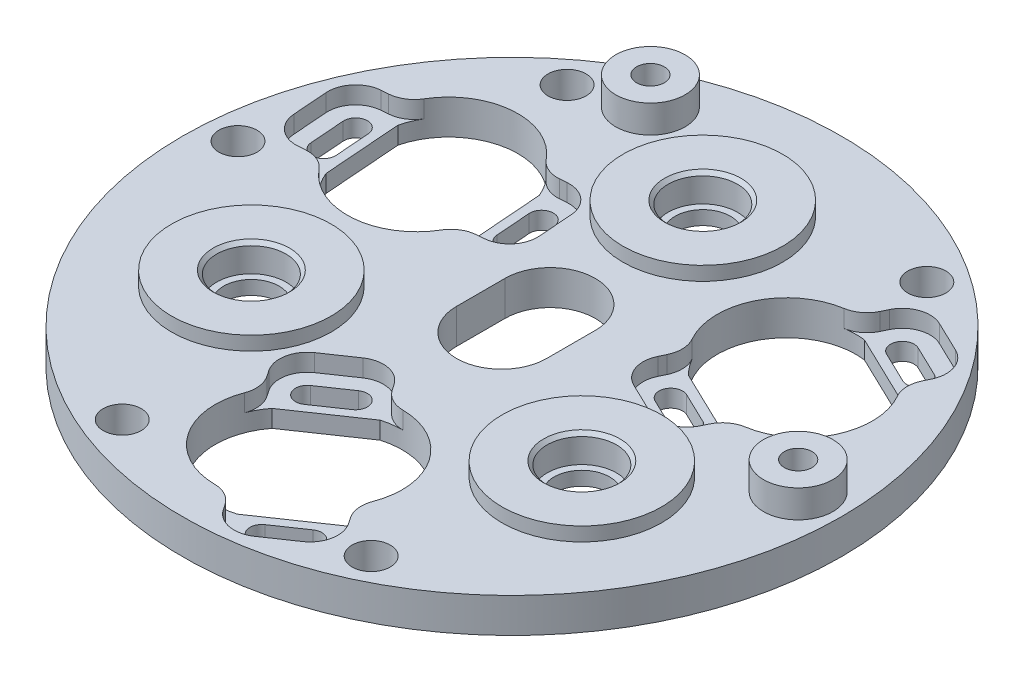
from build123d import *

# Parameters (mm, degrees)
CIRPATTERN1_COUNT            = 3
BOSS_EXTRUDE3_START          = -4
SKETCH3_R                    = 47.5
SKETCH3_R_2                  = 11.5
SKETCH3_R_3                  = 10
BOSS_EXTRUDE3_DEPTH          = 5
R_P_TITION_CIRCULAIRE1_COUNT = 3
ENL_V_MAT_EXTRU_2_DEPTH      = 68.549315319
ENL_V_MAT_EXTRU_2_DEPTH_BACK = 68.549315319
CHANFREIN1_SIZE              = 0.5
CONG_1_R                     = 1
CHANFREIN3_SIZE              = 1.5
ENL_V_START                  = -2.5
ENL_V_MAT_EXTRU_3_DEPTH      = 2.5
ENL_V_MAT_EXTRU_4_REACH      = 69.361
BOSS_EXTRU_1_START           = -5
BOSS_EXTRU_1_DEPTH           = 2.5
CONG_2_R                     = 4
ESQUISSE9_R                  = 5
ESQUISSE9_R_2                = 2
BOSS_EXTRU_2_DEPTH           = 4
M2_CLEARANCE_HOLE1_D         = 2.4
M5_CLEARANCE_HOLE1_D         = 5.5


with BuildPart() as part:
    # Sketch2 → Revolve1 (revolve)
    with BuildSketch(Plane(origin=(0, 0, 0), x_dir=(0, 0, -1), z_dir=(1, 0, 0))):
        Polygon((21, 0), (21, -3), (23.5, -3), (23.5, -1), (22.5, -1), (22.5, 3), (16, 3), (16, -4), (17.5, -4), (17.5, 0), align=None)
    revolve(axis=Axis((0, 24.43625, -27.5), (0, -1, 0)))


with BuildPart() as cirpattern1_1:
    # CirPattern1: pattern copy
    add(part.part.rotate(Axis((0, 0, 0), (0, 1, 0)), 1 * 360 / CIRPATTERN1_COUNT))


with BuildPart() as cirpattern1_2:
    # CirPattern1: pattern copy
    add(part.part.rotate(Axis((0, 0, 0), (0, 1, 0)), 2 * 360 / CIRPATTERN1_COUNT))


with BuildPart() as part_1:
    add(part.part)

    add(cirpattern1_1.part)  # Boss-Extrude3 merges CirPattern1_1

    add(cirpattern1_2.part)  # Boss-Extrude3 merges CirPattern1_2
    # Sketch3 → Boss-Extrude3 (add)
    with BuildSketch(Plane(origin=(0, 0, 0), x_dir=(1, 0, 0), z_dir=(0, 1, 0)).offset(BOSS_EXTRUDE3_START)):
        Circle(SKETCH3_R)
        with Locations(Location((-23.815698604, -13.75, 0), (0, 0, 30))):
            Circle(SKETCH3_R_2, mode=Mode.SUBTRACT)
        with Locations((0, -30)):
            Circle(SKETCH3_R_3, mode=Mode.SUBTRACT)
        with Locations(Location((23.815698604, -13.75, 0), (0, 0, 150))):
            Circle(SKETCH3_R_2, mode=Mode.SUBTRACT)
        with Locations((-25.980762114, 15)):
            Circle(SKETCH3_R_3, mode=Mode.SUBTRACT)
        with BuildLine():
            ThreePointArc((6.5, -1.5), (0, -8), (-6.5, -1.5))
            Line((-6.5, -1.5), (-6.5, 5.5))
            ThreePointArc((-6.5, 5.5), (0, 12), (6.5, 5.5))
            Line((6.5, 5.5), (6.5, -1.5))
        make_face(mode=Mode.SUBTRACT)
        with Locations((25.980762114, 15)):
            Circle(SKETCH3_R_3, mode=Mode.SUBTRACT)
        with Locations(Location((0, 27.5, 0), (0, 0, 270))):
            Circle(SKETCH3_R_2, mode=Mode.SUBTRACT)
    extrude(amount=BOSS_EXTRUDE3_DEPTH)

    # Esquisse4 → Révolution1 (revolve)
    with BuildSketch(Plane(origin=(0, 0, 0), x_dir=(0, 0, -1), z_dir=(1, 0, 0))):
        Polygon((-38, -4.6), (-38, -0.6), (-38.4, -0.6), (-38.4, 0.5), (-38, 0.5), (-38, 1.5), (-40, 1.5), (-40, -6.1), (-36.5, -6.1), (-36.5, -4.6), align=None)
    r_volution1 = revolve(axis=Axis((0, 11.147589679, 30), (0, -1, 0)))

    # Répétition circulaire1: Révolution1 ×3 about axis
    r_p_tition_circulaire1_axis = Axis((0, 0, 0), (0, 1, 0))
    for i in range(1, R_P_TITION_CIRCULAIRE1_COUNT):
        add(r_volution1.rotate(r_p_tition_circulaire1_axis, i * 360 / R_P_TITION_CIRCULAIRE1_COUNT))

    # Esquisse6 → Enlèv. mat.-Extru.2 (cut, two sides: drawn at the far end of the back side and taken through both)
    with BuildSketch(Plane(origin=(0, 1, 0), x_dir=(1, 0, 0), z_dir=(0, 1, 0)).offset(-ENL_V_MAT_EXTRU_2_DEPTH_BACK)):
        with BuildLine():
            Line((27.61293062, 25.311936092), (32.118566189, 23.144161168))
            ThreePointArc((32.118566189, 23.144161168), (36.794287479, 9.797340183), (23.447466493, 5.121618893))
            Line((23.447466493, 5.121618893), (18.941830925, 7.289393816))
            ThreePointArc((18.941830925, 7.289393816), (14.266109634, 20.636214802), (27.61293062, 25.311936092))
        make_face()
        with BuildLine():
            Line((8.114314365, -36.569467436), (3.984148427, -39.387574837))
            ThreePointArc((3.984148427, -39.387574837), (-9.912398252, -36.763457762), (-7.288281177, -22.866911084))
            Line((-7.288281177, -22.866911084), (-3.158115239, -20.048803683))
            ThreePointArc((-3.158115239, -20.048803683), (10.738431439, -22.672920758), (8.114314365, -36.569467436))
        make_face()
        with BuildLine():
            Line((-35.727244985, 11.257531344), (-36.102714615, 16.243413668))
            ThreePointArc((-36.102714615, 16.243413668), (-26.881889227, 26.966117579), (-16.159185316, 17.745292191))
            Line((-16.159185316, 17.745292191), (-15.783715686, 12.759409867))
            ThreePointArc((-15.783715686, 12.759409867), (-25.004541074, 2.036705956), (-35.727244985, 11.257531344))
        make_face()
    extrude(amount=ENL_V_MAT_EXTRU_2_DEPTH + ENL_V_MAT_EXTRU_2_DEPTH_BACK, mode=Mode.SUBTRACT)

    # Chanfrein1
    chanfrein1_edges = [part_1.edges().sort_by_distance(p)[0] for p in [
        (0, 3, -32.5),
        (28.145825623, 3, 16.25),
        (-28.145825623, 3, 16.25),
    ]]
    chamfer(chanfrein1_edges, length=CHANFREIN1_SIZE)

    # Congé1
    cong_1_edges = [part_1.edges().sort_by_distance(p)[0] for p in [
        (0, 0, -37.5),
        (29.444863729, 0, 17),
        (32.475952642, 0, 18.75),
        (-29.444863729, 0, 17),
        (-32.475952642, 0, 18.75),
        (0, 0, -34),
    ]]
    fillet(cong_1_edges, radius=CONG_1_R)

    # Chanfrein3
    chanfrein3_edges = [part_1.edges().sort_by_distance(p)[0] for p in [
        (0, -4, -37.5),
        (32.475952642, -4, 18.75),
        (-32.475952642, -4, 18.75),
    ]]
    chamfer(chanfrein3_edges, length=CHANFREIN3_SIZE)

    # Esquisse7 → Enlèv. mat.-Extru.3 (cut)
    with BuildSketch(Plane(origin=(0, 1, 0), x_dir=(1, 0, 0), z_dir=(0, 1, 0)).offset(ENL_V_START)):
        with BuildLine():
            ThreePointArc((3.984148427, -39.387574837), (2.177594413, -40.364867019), (0.209477067, -40.952448099))
            Line((0.209477067, -40.952448099), (2.089069377, -43.707143727))
            ThreePointArc((2.089069377, -43.707143727), (4.650989736, -45.383194762), (7.647688048, -44.756790556))
            Line((7.647688048, -44.756790556), (11.777853986, -41.938683155))
            ThreePointArc((11.777853986, -41.938683155), (13.453905022, -39.376762796), (12.827500816, -36.380064484))
            Line((12.827500816, -36.380064484), (10.947908506, -33.625368856))
            ThreePointArc((10.947908506, -33.625368856), (9.683091276, -35.243693542), (8.114314365, -36.569467436))
            Line((8.114314365, -36.569467436), (3.984148427, -39.387574837))
        make_face()
        with BuildLine():
            Line((-6.82165486, -14.679587964), (-10.951820798, -17.497695364))
            ThreePointArc((-10.951820798, -17.497695364), (-12.627871834, -20.059615724), (-12.001467628, -23.056314036))
            Line((-12.001467628, -23.056314036), (-10.121875318, -25.811009663))
            ThreePointArc((-10.121875318, -25.811009663), (-8.857058088, -24.192684978), (-7.288281177, -22.866911084))
            Line((-7.288281177, -22.866911084), (-3.158115239, -20.048803683))
            ThreePointArc((-3.158115239, -20.048803683), (-1.351561225, -19.071511501), (0.616556121, -18.483930421))
            Line((0.616556121, -18.483930421), (-1.263036189, -15.729234793))
            ThreePointArc((-1.263036189, -15.729234793), (-3.824956548, -14.053183758), (-6.82165486, -14.679587964))
        make_face()
        with BuildLine():
            ThreePointArc((-38.896031482, 20.044384713), (-41.628494437, 18.663722117), (-42.584361638, 15.755303148))
            Line((-42.584361638, 15.755303148), (-42.208892007, 10.769420824))
            ThreePointArc((-42.208892007, 10.769420824), (-40.828229411, 8.036957869), (-37.919810442, 7.081090668))
            Line((-37.919810442, 7.081090668), (-34.594377894, 7.331517544))
            ThreePointArc((-34.594377894, 7.331517544), (-35.363479569, 9.236043739), (-35.727244985, 11.257531344))
            Line((-35.727244985, 11.257531344), (-36.102714615, 16.243413668))
            ThreePointArc((-36.102714615, 16.243413668), (-36.045797465, 18.296581429), (-35.570598934, 20.294811588))
            Line((-35.570598934, 20.294811588), (-38.896031482, 20.044384713))
        make_face()
        with BuildLine():
            Line((-16.159185316, 17.745292191), (-15.783715686, 12.759409867))
            ThreePointArc((-15.783715686, 12.759409867), (-15.840632836, 10.706242106), (-16.315831367, 8.708011947))
            Line((-16.315831367, 8.708011947), (-12.990398819, 8.958438822))
            ThreePointArc((-12.990398819, 8.958438822), (-10.257935864, 10.339101418), (-9.302068663, 13.247520387))
            Line((-9.302068663, 13.247520387), (-9.677538294, 18.233402711))
            ThreePointArc((-9.677538294, 18.233402711), (-11.05820089, 20.965865666), (-13.966619859, 21.921732867))
            Line((-13.966619859, 21.921732867), (-17.292052407, 21.671305991))
            ThreePointArc((-17.292052407, 21.671305991), (-16.522950732, 19.766779796), (-16.159185316, 17.745292191))
        make_face()
        with BuildLine():
            ThreePointArc((36.806962106, 23.662759014), (36.977504701, 26.719472645), (34.93667359, 29.001487408))
            Line((34.93667359, 29.001487408), (30.431038021, 31.169262332))
            ThreePointArc((30.431038021, 31.169262332), (27.374324389, 31.339804927), (25.092309627, 29.298973816))
            Line((25.092309627, 29.298973816), (23.646469388, 26.293851313))
            ThreePointArc((23.646469388, 26.293851313), (25.680388293, 26.007649803), (27.61293062, 25.311936092))
            Line((27.61293062, 25.311936092), (32.118566189, 23.144161168))
            ThreePointArc((32.118566189, 23.144161168), (33.868203052, 22.06828559), (35.361121867, 20.657636511))
            Line((35.361121867, 20.657636511), (36.806962106, 23.662759014))
        make_face()
        with BuildLine():
            Line((23.447466493, 5.121618893), (18.941830925, 7.289393816))
            ThreePointArc((18.941830925, 7.289393816), (17.192194061, 8.365269395), (15.699275246, 9.775918474))
            Line((15.699275246, 9.775918474), (14.253435008, 6.770795971))
            ThreePointArc((14.253435008, 6.770795971), (14.082892412, 3.71408234), (16.123723524, 1.432067577))
            Line((16.123723524, 1.432067577), (20.629359093, -0.735707347))
            ThreePointArc((20.629359093, -0.735707347), (23.686072724, -0.906249942), (25.968087487, 1.134581169))
            Line((25.968087487, 1.134581169), (27.413927725, 4.139703672))
            ThreePointArc((27.413927725, 4.139703672), (25.380008821, 4.425905182), (23.447466493, 5.121618893))
        make_face()
    extrude(amount=ENL_V_MAT_EXTRU_3_DEPTH, mode=Mode.SUBTRACT)

    # Esquisse8 → Enlèv. mat.-Extru.4 (cut, up to next)
    with BuildSketch(Plane(origin=(0, 1, 0), x_dir=(1, 0, 0), z_dir=(0, 1, 0)), mode=Mode.PRIVATE) as enl_v_mat_extru_4_sk1:
        with BuildLine():
            Line((-9.655491394, -19.397571696), (-5.525325456, -16.579464295))
            ThreePointArc((-5.525325456, -16.579464295), (-3.162912521, -17.025564198), (-3.609012423, -19.387977133))
            Line((-3.609012423, -19.387977133), (-7.739178361, -22.206084534))
            ThreePointArc((-7.739178361, -22.206084534), (-10.101591297, -21.759984631), (-9.655491394, -19.397571696))
        make_face()
    enl_v_mat_extru_4_tool1 = extrude(enl_v_mat_extru_4_sk1.sketch, amount=-ENL_V_MAT_EXTRU_4_REACH, mode=Mode.PRIVATE) & part_1.part
    # Esquisse8 → Enlèv. mat.-Extru.4 (cut, up to next)
    with BuildSketch(Plane(origin=(0, 1, 0), x_dir=(1, 0, 0), z_dir=(0, 1, 0)), mode=Mode.PRIVATE) as enl_v_mat_extru_4_sk2:
        with BuildLine():
            Line((4.435045611, -40.048401387), (8.565211549, -37.230293986))
            ThreePointArc((8.565211549, -37.230293986), (10.927624484, -37.676393888), (10.481524582, -40.038806824))
            Line((10.481524582, -40.038806824), (6.351358643, -42.856914225))
            ThreePointArc((6.351358643, -42.856914225), (3.988945708, -42.410814322), (4.435045611, -40.048401387))
        make_face()
    enl_v_mat_extru_4_tool2 = extrude(enl_v_mat_extru_4_sk2.sketch, amount=-ENL_V_MAT_EXTRU_4_REACH, mode=Mode.PRIVATE) & part_1.part
    # Esquisse8 → Enlèv. mat.-Extru.4 (cut, up to next)
    with BuildSketch(Plane(origin=(0, 1, 0), x_dir=(1, 0, 0), z_dir=(0, 1, 0)), mode=Mode.PRIVATE) as enl_v_mat_extru_4_sk3:
        with BuildLine():
            Line((21.626535557, 1.336885015), (17.120899989, 3.504659939))
            ThreePointArc((17.120899989, 3.504659939), (16.326027369, 5.773619506), (18.594986937, 6.568492125))
            Line((18.594986937, 6.568492125), (23.100622506, 4.400717202))
            ThreePointArc((23.100622506, 4.400717202), (23.895495125, 2.131757634), (21.626535557, 1.336885015))
        make_face()
    enl_v_mat_extru_4_tool3 = extrude(enl_v_mat_extru_4_sk3.sketch, amount=-ENL_V_MAT_EXTRU_4_REACH, mode=Mode.PRIVATE) & part_1.part
    # Esquisse8 → Enlèv. mat.-Extru.4 (cut, up to next)
    with BuildSketch(Plane(origin=(0, 1, 0), x_dir=(1, 0, 0), z_dir=(0, 1, 0)), mode=Mode.PRIVATE) as enl_v_mat_extru_4_sk4:
        with BuildLine():
            Line((32.465410177, 23.865062859), (27.959774608, 26.032837783))
            ThreePointArc((27.959774608, 26.032837783), (27.164901988, 28.301797351), (29.433861556, 29.09666997))
            Line((29.433861556, 29.09666997), (33.939497125, 26.928895046))
            ThreePointArc((33.939497125, 26.928895046), (34.734369744, 24.659935479), (32.465410177, 23.865062859))
        make_face()
    enl_v_mat_extru_4_tool4 = extrude(enl_v_mat_extru_4_sk4.sketch, amount=-ENL_V_MAT_EXTRU_4_REACH, mode=Mode.PRIVATE) & part_1.part
    # Esquisse8 → Enlèv. mat.-Extru.4 (cut, up to next)
    with BuildSketch(Plane(origin=(0, 1, 0), x_dir=(1, 0, 0), z_dir=(0, 1, 0)), mode=Mode.PRIVATE) as enl_v_mat_extru_4_sk5:
        with BuildLine():
            Line((-14.985974514, 12.819485008), (-15.361444144, 17.805367332))
            ThreePointArc((-15.361444144, 17.805367332), (-13.793903828, 19.628226997), (-11.971044164, 18.060686681))
            Line((-11.971044164, 18.060686681), (-11.595574533, 13.074804356))
            ThreePointArc((-11.595574533, 13.074804356), (-13.163114849, 11.251944692), (-14.985974514, 12.819485008))
        make_face()
    enl_v_mat_extru_4_tool5 = extrude(enl_v_mat_extru_4_sk5.sketch, amount=-ENL_V_MAT_EXTRU_4_REACH, mode=Mode.PRIVATE) & part_1.part
    # Esquisse8 → Enlèv. mat.-Extru.4 (cut, up to next)
    with BuildSketch(Plane(origin=(0, 1, 0), x_dir=(1, 0, 0), z_dir=(0, 1, 0)), mode=Mode.PRIVATE) as enl_v_mat_extru_4_sk6:
        with BuildLine():
            Line((-39.915386137, 10.942136854), (-40.290855768, 15.928019179))
            ThreePointArc((-40.290855768, 15.928019179), (-38.723315452, 17.750878843), (-36.900455787, 16.183338528))
            Line((-36.900455787, 16.183338528), (-36.524986157, 11.197456203))
            ThreePointArc((-36.524986157, 11.197456203), (-38.092526473, 9.374596538), (-39.915386137, 10.942136854))
        make_face()
    enl_v_mat_extru_4_tool6 = extrude(enl_v_mat_extru_4_sk6.sketch, amount=-ENL_V_MAT_EXTRU_4_REACH, mode=Mode.PRIVATE) & part_1.part
    add(enl_v_mat_extru_4_tool1.solids().sort_by_distance((-6.632252, 1, 19.392774))[0], mode=Mode.SUBTRACT)
    add(enl_v_mat_extru_4_tool2.solids().sort_by_distance((7.458285, 1, 40.043604))[0], mode=Mode.SUBTRACT)
    add(enl_v_mat_extru_4_tool3.solids().sort_by_distance((20.110761, 1, -3.952689))[0], mode=Mode.SUBTRACT)
    add(enl_v_mat_extru_4_tool4.solids().sort_by_distance((30.949636, 1, -26.480866))[0], mode=Mode.SUBTRACT)
    add(enl_v_mat_extru_4_tool5.solids().sort_by_distance((-13.478509, 1, -15.440086))[0], mode=Mode.SUBTRACT)
    add(enl_v_mat_extru_4_tool6.solids().sort_by_distance((-38.407921, 1, -13.562738))[0], mode=Mode.SUBTRACT)

    # Esquisse8<2> → Boss.-Extru.1 (add)
    with BuildSketch(Plane(origin=(0, 1, 0), x_dir=(1, 0, 0), z_dir=(0, 1, 0)).offset(BOSS_EXTRU_1_START)):
        with BuildLine():
            Line((8.114314365, -36.569467436), (3.984148427, -39.387574837))
            ThreePointArc((3.984148427, -39.387574837), (2.607176673, -40.174830963), (1.123049885, -40.734465751))
            Line((1.123049885, -40.734465751), (10.411791426, -34.396543334))
            ThreePointArc((10.411791426, -34.396543334), (9.349488907, -35.574395946), (8.114314365, -36.569467436))
        make_face()
        with BuildLine():
            Line((-7.288281177, -22.866911084), (-3.158115239, -20.048803683))
            ThreePointArc((-3.158115239, -20.048803683), (-1.781143485, -19.261547557), (-0.297016697, -18.701912769))
            Line((-0.297016697, -18.701912769), (-9.585758239, -25.039835186))
            ThreePointArc((-9.585758239, -25.039835186), (-8.523455719, -23.861982574), (-7.288281177, -22.866911084))
        make_face()
        with BuildLine():
            Line((-35.727244985, 11.257531344), (-36.102714615, 16.243413668))
            ThreePointArc((-36.102714615, 16.243413668), (-36.096012543, 17.829534251), (-35.838607092, 19.394643145))
            Line((-35.838607092, 19.394643145), (-34.994176043, 8.181395793))
            ThreePointArc((-34.994176043, 8.181395793), (-35.483075067, 9.690303067), (-35.727244985, 11.257531344))
        make_face()
        with BuildLine():
            Line((27.61293062, 25.311936092), (32.118566189, 23.144161168))
            ThreePointArc((32.118566189, 23.144161168), (33.48883587, 22.345296712), (34.715557207, 21.339822605))
            Line((34.715557207, 21.339822605), (24.582384617, 26.215147541))
            ThreePointArc((24.582384617, 26.215147541), (26.13358616, 25.884092879), (27.61293062, 25.311936092))
        make_face()
        with BuildLine():
            Line((-16.892254258, 20.821427742), (-16.047823209, 9.60818039))
            ThreePointArc((-16.047823209, 9.60818039), (-15.790417758, 11.173289285), (-15.783715686, 12.759409867))
            Line((-15.783715686, 12.759409867), (-16.159185316, 17.745292191))
            ThreePointArc((-16.159185316, 17.745292191), (-16.403355234, 19.312520468), (-16.892254258, 20.821427742))
        make_face()
        with BuildLine():
            Line((26.478012497, 4.218407444), (16.344839906, 9.093732379))
            ThreePointArc((16.344839906, 9.093732379), (17.571561243, 8.088258273), (18.941830925, 7.289393816))
            Line((18.941830925, 7.289393816), (23.447466493, 5.121618893))
            ThreePointArc((23.447466493, 5.121618893), (24.926810953, 4.549462106), (26.478012497, 4.218407444))
        make_face()
    extrude(amount=BOSS_EXTRU_1_DEPTH)

    # Congé2
    cong_2_edges = [part_1.edges().sort_by_distance(p)[0] for p in [
        (-35.570598934, -0.25, -20.294811588),
        (-34.594377894, -0.25, -7.331517544),
        (0.209477067, -0.25, 40.952448099),
        (10.947908506, -0.25, 33.625368856),
        (15.699275246, -0.25, -9.775918474),
        (27.413927725, -0.25, -4.139703672),
        (35.361121867, -0.25, -20.657636511),
        (23.646469388, -0.25, -26.293851313),
        (-16.315831367, -0.25, -8.708011947),
        (-17.292052407, -0.25, -21.671305991),
        (0.616556121, -0.25, 18.483930421),
        (-10.121875318, -0.25, 25.811009663),
    ]]
    fillet(cong_2_edges, radius=CONG_2_R)

    # Esquisse9 → Boss.-Extru.2 (add)
    # profile 1 of 2: a face of its own
    with BuildSketch(Plane(origin=(0, 1, 0), x_dir=(1, 0, 0), z_dir=(0, 1, 0))):
        with Locations((-17.433003297, 37.385196215)):
            Circle(ESQUISSE9_R)
        with Locations(Location((-17.433003297, 37.385196215, 0), (0, 0, 180))):
            Circle(ESQUISSE9_R_2, mode=Mode.SUBTRACT)
    # profile 2 of 2: a face of its own
    with BuildSketch(Plane(origin=(0, 1, 0), x_dir=(1, 0, 0), z_dir=(0, 1, 0))):
        with Locations((41.25, 0)):
            Circle(ESQUISSE9_R)
        with Locations(Location((41.25, 0, 0), (0, 0, 180))):
            Circle(ESQUISSE9_R_2, mode=Mode.SUBTRACT)
    extrude(amount=BOSS_EXTRU_2_DEPTH)

    # M2 Clearance Hole1 (through all)
    with Locations(Plane(origin=(0, 1, 0), x_dir=(1, 0, 0), z_dir=(0, 1, 0))):
        with Locations((-17.433003297, 37.385196215), (41.25, 0)):
            Hole(M2_CLEARANCE_HOLE1_D / 2)

    # M5 Clearance Hole1 (through all)
    with Locations(Plane(origin=(0, 1, 0), x_dir=(1, 0, 0), z_dir=(0, 1, 0))):
        with Locations((-26.176741447, 34.114193633), (24.355468188, 35.437426111), (18.511977163, -38.811167227), (-16.455387592, -39.726819898), (-42.867445351, 3.373741116)):
            Hole(M5_CLEARANCE_HOLE1_D / 2)


solid = part_1.part
